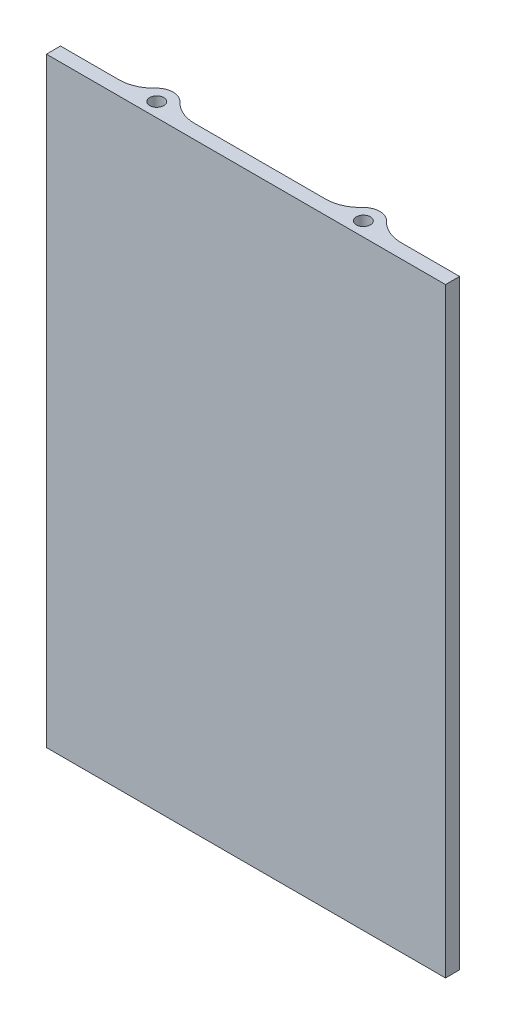
from build123d import *

# Parameters (mm, degrees)
SKETCH1_R           = 3
BOSS_EXTRUDE1_DEPTH = 255.8


with BuildPart() as part:
    # Sketch1 → Boss-Extrude1 (new body)
    with BuildSketch(Plane(origin=(0, 0, 0), x_dir=(1, 0, 0), z_dir=(0, 1, 0))):
        with BuildLine():
            Line((-85, 6), (-85, 0))
            Line((-85, 0), (85, 0))
            Line((85, 0), (85, 6))
            Line((85, 6), (60.093476939, 6))
            ThreePointArc((60.093476939, 6), (54.110546675, 7.244835681), (49.120651753, 10.772727273))
            ThreePointArc((49.120651753, 10.772727273), (44, 13), (38.879348247, 10.772727273))
            ThreePointArc((38.879348247, 10.772727273), (33.889453325, 7.244835681), (27.906523061, 6))
            Line((27.906523061, 6), (-27.906523061, 6))
            ThreePointArc((-27.906523061, 6), (-33.889453325, 7.244835681), (-38.879348247, 10.772727273))
            ThreePointArc((-38.879348247, 10.772727273), (-44, 13), (-49.120651753, 10.772727273))
            ThreePointArc((-49.120651753, 10.772727273), (-54.110546675, 7.244835681), (-60.093476939, 6))
            Line((-60.093476939, 6), (-85, 6))
        make_face()
        with Locations((-44, 6)):
            Circle(SKETCH1_R, mode=Mode.SUBTRACT)
        with Locations((44, 6)):
            Circle(SKETCH1_R, mode=Mode.SUBTRACT)
    extrude(amount=BOSS_EXTRUDE1_DEPTH)


solid = part.part
